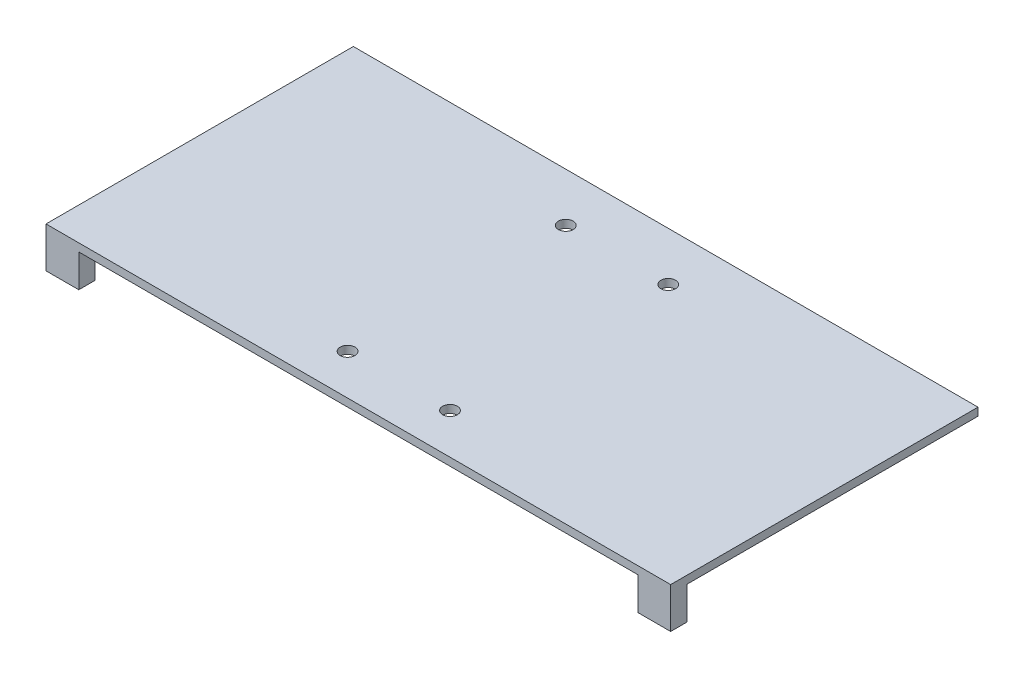
from build123d import *

# Parameters (mm, degrees)
SKETCH1_W           = 96.799999948
SKETCH1_H           = 47.62500254
BOSS_EXTRUDE1_DEPTH = 1.2192
CUT_EXTRUDE1_REACH  = 109.888
SKETCH5_R           = 1.143
CUT_EXTRUDE2_REACH  = 109.888
SKETCH6_R           = 1.143
SKETCH7_W           = 5.08
SKETCH7_H           = 2.54
BOSS_EXTRUDE2_DEPTH = 5.08


with BuildPart() as part:
    # Sketch1 → Boss-Extrude1 (new body)
    with BuildSketch(Plane(origin=(0, 0, 0), x_dir=(1, 0, 0), z_dir=(0, 1, 0))):
        with Locations((48.399999974, -23.81250127)):
            Rectangle(SKETCH1_W, SKETCH1_H)
    extrude(amount=BOSS_EXTRUDE1_DEPTH)

    # Sketch5 → Cut-Extrude1 (cut, up to next)
    with BuildSketch(Plane(origin=(0, 1.2192, 0), x_dir=(1, 0, 0), z_dir=(0, 1, 0)), mode=Mode.PRIVATE) as cut_extrude1_sk1:
        with Locations((56.3375, -7.540625)):
            Circle(SKETCH5_R)
    cut_extrude1_tool1 = extrude(cut_extrude1_sk1.sketch, amount=-CUT_EXTRUDE1_REACH, mode=Mode.PRIVATE) & part.part
    # Sketch5 → Cut-Extrude1 (cut, up to next)
    with BuildSketch(Plane(origin=(0, 1.2192, 0), x_dir=(1, 0, 0), z_dir=(0, 1, 0)), mode=Mode.PRIVATE) as cut_extrude1_sk2:
        with Locations((40.4625, -7.540625)):
            Circle(SKETCH5_R)
    cut_extrude1_tool2 = extrude(cut_extrude1_sk2.sketch, amount=-CUT_EXTRUDE1_REACH, mode=Mode.PRIVATE) & part.part
    add(cut_extrude1_tool1.solids().sort_by_distance((56.3375, 1.2192, 7.540625))[0], mode=Mode.SUBTRACT)
    add(cut_extrude1_tool2.solids().sort_by_distance((40.4625, 1.2192, 7.540625))[0], mode=Mode.SUBTRACT)

    # Sketch6 → Cut-Extrude2 (cut, up to next)
    with BuildSketch(Plane(origin=(0, 1.2192, 0), x_dir=(1, 0, 0), z_dir=(0, 1, 0)), mode=Mode.PRIVATE) as cut_extrude2_sk1:
        with Locations((56.3375, -41.35437754)):
            Circle(SKETCH6_R)
    cut_extrude2_tool1 = extrude(cut_extrude2_sk1.sketch, amount=-CUT_EXTRUDE2_REACH, mode=Mode.PRIVATE) & part.part
    # Sketch6 → Cut-Extrude2 (cut, up to next)
    with BuildSketch(Plane(origin=(0, 1.2192, 0), x_dir=(1, 0, 0), z_dir=(0, 1, 0)), mode=Mode.PRIVATE) as cut_extrude2_sk2:
        with Locations((40.4625, -41.35437754)):
            Circle(SKETCH6_R)
    cut_extrude2_tool2 = extrude(cut_extrude2_sk2.sketch, amount=-CUT_EXTRUDE2_REACH, mode=Mode.PRIVATE) & part.part
    add(cut_extrude2_tool1.solids().sort_by_distance((56.3375, 1.2192, 41.354378))[0], mode=Mode.SUBTRACT)
    add(cut_extrude2_tool2.solids().sort_by_distance((40.4625, 1.2192, 41.354378))[0], mode=Mode.SUBTRACT)

    # Sketch7 → Boss-Extrude2 (add)
    with BuildSketch(Plane(origin=(0, 0, 0), x_dir=(-1, 0, 0), z_dir=(0, -1, 0))):
        with Locations((-94.259999948, -46.35500254)):
            Rectangle(SKETCH7_W, SKETCH7_H)
        with Locations((-2.54, -46.35500254)):
            Rectangle(SKETCH7_W, SKETCH7_H)
    extrude(amount=BOSS_EXTRUDE2_DEPTH)


solid = part.part
